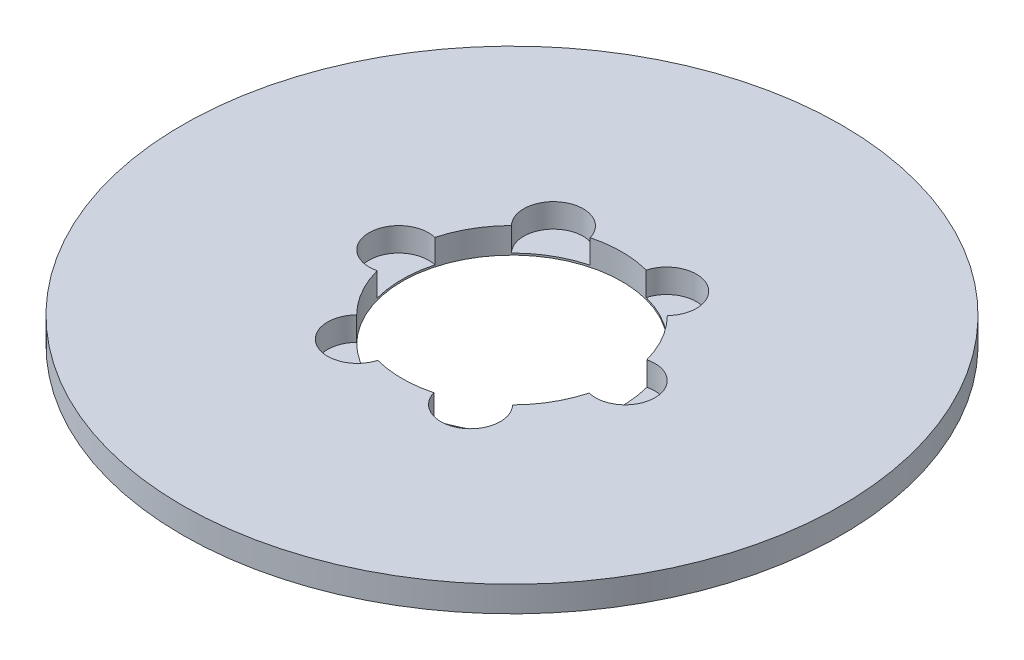
from build123d import *

# Parameters (mm, degrees)
SKETCH1_R           = 90
BOSS_EXTRUDE1_DEPTH = 7
SKETCH2_R           = 30
CUT_EXTRUDE1_DEPTH  = 128.471565457
SKETCH3_R           = 8.117868842
CUT_EXTRUDE2_DEPTH  = 6.505273873
CIRPATTERN1_COUNT   = 6


with BuildPart() as part:
    # Sketch1 → Boss-Extrude1 (new body)
    with BuildSketch(Plane(origin=(0, 0, 0), x_dir=(1, 0, 0), z_dir=(0, 1, 0))):
        Circle(SKETCH1_R)
    extrude(amount=BOSS_EXTRUDE1_DEPTH)

    # Sketch2 → Cut-Extrude1 (cut, through all)
    with BuildSketch(Plane(origin=(0, 0, 0), x_dir=(1, 0, 0), z_dir=(0, 1, 0))):
        Circle(SKETCH2_R)
    extrude(amount=CUT_EXTRUDE1_DEPTH, mode=Mode.SUBTRACT)

    # Sketch3 → Cut-Extrude2 (cut)
    with BuildSketch(Plane(origin=(0, 7, 0), x_dir=(1, 0, 0), z_dir=(0, 1, 0))):
        with Locations((-30.923170161, 0)):
            Circle(SKETCH3_R)
    cut_extrude2 = extrude(amount=-CUT_EXTRUDE2_DEPTH, mode=Mode.SUBTRACT)

    # CirPattern1: Cut-Extrude2 ×6 about axis
    cirpattern1_axis = Axis((0, 0, 0), (0, 1, 0))
    for i in range(1, CIRPATTERN1_COUNT):
        add(cut_extrude2.rotate(cirpattern1_axis, i * 360 / CIRPATTERN1_COUNT), mode=Mode.SUBTRACT)


solid = part.part
